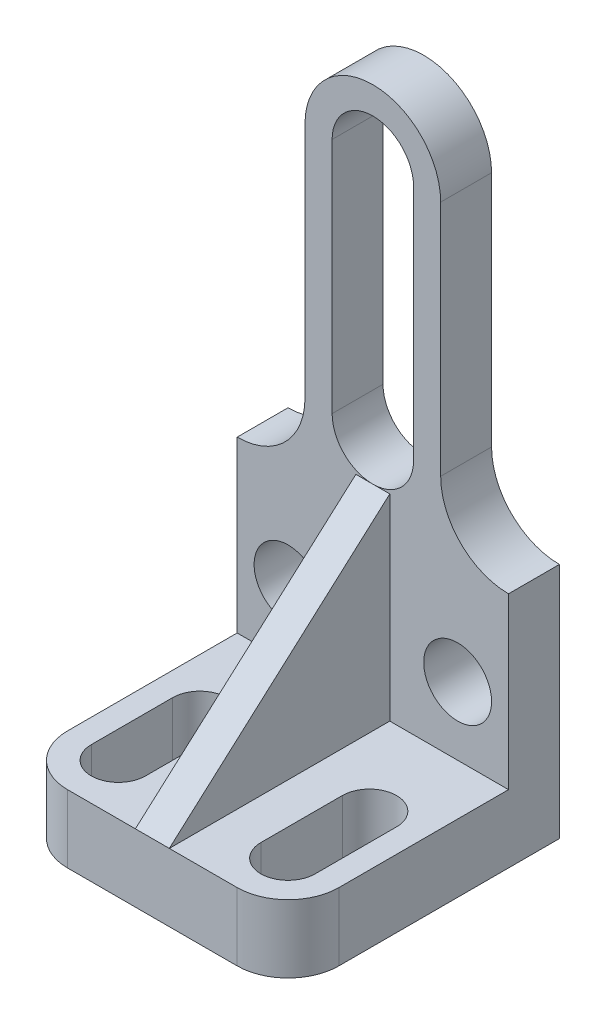
from build123d import *

# Parameters (mm, degrees)
BOSS_EXTRUDE1_DEPTH = 80
FILLET1_R           = 15
CUT_EXTRUDE1_DEPTH  = 196.959179423
SKETCH14_R          = 10
CUT_EXTRUDE2_DEPTH  = 208.424685127
CUT_EXTRUDE4_DEPTH  = 208.424685127
FILLET2_R           = 20
FILLET3_R           = 20
RIB7_REACH          = 202.998
SKETCH21_WALL_W     = 491.109891544
SKETCH21_WALL_H     = 10
CUT_EXTRUDE5_DEPTH  = 6


with BuildPart() as part:
    # Sketch1 → Boss-Extrude1 (new body)
    with BuildSketch(Plane(origin=(0, 0, 0), x_dir=(0, 0, -1), z_dir=(1, 0, 0))):
        Polygon((0, 0), (0, 180), (-15, 180), (-15, 20), (-80, 20), (-80, 0), align=None)
    extrude(amount=-BOSS_EXTRUDE1_DEPTH)

    # Fillet1
    fillet1_edges = [part.edges().sort_by_distance(p)[0] for p in [
        (-80, 10, 80),
        (0, 10, 80),
    ]]
    fillet(fillet1_edges, radius=FILLET1_R)

    # Sketch8 → Cut-Extrude1 (cut, through all)
    with BuildSketch(Plane(origin=(0, 20, 0), x_dir=(1, 0, 0), z_dir=(0, 1, 0))):
        with BuildLine():
            Line((-73, -65), (-73, -41))
            ThreePointArc((-73, -41), (-65, -33), (-57, -41))
            Line((-57, -41), (-57, -65))
            ThreePointArc((-57, -65), (-65, -73), (-73, -65))
        make_face()
        with BuildLine():
            Line((-23, -65), (-23, -41))
            ThreePointArc((-23, -41), (-15, -33), (-7, -41))
            Line((-7, -41), (-7, -65))
            ThreePointArc((-7, -65), (-15, -73), (-23, -65))
        make_face()
    extrude(amount=-CUT_EXTRUDE1_DEPTH, mode=Mode.SUBTRACT)

    # Sketch14 → Cut-Extrude2 (cut, through all)
    with BuildSketch(Plane.XY.offset(15)):
        with Locations((-65, 40)):
            Circle(SKETCH14_R)
        with Locations((-15, 40)):
            Circle(SKETCH14_R)
    extrude(amount=-CUT_EXTRUDE2_DEPTH, mode=Mode.SUBTRACT)

    # Sketch11 → Cut-Extrude4 (cut, through all)
    with BuildSketch(Plane.XY.offset(15)):
        with BuildLine():
            Line((-60, 70), (-60, 160))
            ThreePointArc((-60, 160), (-54.142135624, 174.142135624), (-40, 180))
            Line((-40, 180), (-80, 180))
            Line((-80, 180), (-80, 70))
            Line((-80, 70), (-60, 70))
        make_face()
        with BuildLine():
            Line((0, 180), (-40, 180))
            ThreePointArc((-40, 180), (-25.857864376, 174.142135624), (-20, 160))
            Line((-20, 160), (-20, 70))
            Line((-20, 70), (0, 70))
            Line((0, 70), (0, 180))
        make_face()
        with BuildLine():
            Line((-52, 160), (-52, 90))
            ThreePointArc((-52, 90), (-40, 78), (-28, 90))
            Line((-28, 90), (-28, 160))
            ThreePointArc((-28, 160), (-40, 172), (-52, 160))
        make_face()
    extrude(amount=-CUT_EXTRUDE4_DEPTH, mode=Mode.SUBTRACT)

    # Fillet2
    fillet2_edges = [part.edges().sort_by_distance(p)[0] for p in [
        (-20, 70, 7.5),
    ]]
    fillet(fillet2_edges, radius=FILLET2_R - 0.0001)  # a hair under: the kernel refuses the full size

    # Fillet3
    fillet3_edges = [part.edges().sort_by_distance(p)[0] for p in [
        (-60, 70, 7.5),
    ]]
    fillet(fillet3_edges, radius=FILLET3_R - 0.0001)  # a hair under: the kernel refuses the full size

    # Sketch21 wall → Rib7 (add, up to next)
    with BuildSketch(Plane(origin=(-40, 49, 47.5), x_dir=(0, -0.665787622684, 0.746141301284), z_dir=(0, -0.746141301284, -0.665787622684)), mode=Mode.PRIVATE) as rib7_sk1:
        Rectangle(SKETCH21_WALL_W, SKETCH21_WALL_H)
    rib7_tool1 = extrude(rib7_sk1.sketch, amount=RIB7_REACH, mode=Mode.PRIVATE) - part.part
    add(rib7_tool1.solids().sort_by_distance((-40, 49, 47.5))[0])

    # Sketch22 → Cut-Extrude5 (cut)
    # profile 1 of 7: a face of its own
    with BuildSketch(Plane.ZY.offset(80)):
        with BuildLine():
            Line((3.679487179, 2.857772436), (3.404647436, 2.647435897))
            add(Edge.make_bspline(
                [(3.404647436, 2.647435897), (3.385041548, 2.670801867), (3.346094101, 2.717218783), (3.283434898, 2.782398327), (3.218133255, 2.843463589), (3.150214134, 2.900705469), (3.078455015, 2.952122234), (3.004594216, 3.000393337), (2.927396171, 3.043661075), (2.820644436, 3.096124061), (2.680996588, 3.150870216), (2.505201749, 3.196773448), (2.32169065, 3.225994623), (2.196493051, 3.229159465), (2.1328125, 3.230769231)],
                knots=[0, 0, 0, 0, 0.757959112, 1.505699292, 2.245454638, 2.979532153, 3.711538275, 4.438200793, 5.171680507, 5.909471876, 7.393775596, 8.890124382, 10.418191784, 12, 12, 12, 12], degree=3))
            add(Edge.make_bspline(
                [(2.1328125, 3.230769231), (2.097729201, 3.230365268), (2.027888208, 3.229561092), (1.924239735, 3.218951967), (1.822526683, 3.204040757), (1.722815217, 3.181915434), (1.625232259, 3.153942815), (1.529139857, 3.120517401), (1.435929257, 3.079162561), (1.344311019, 3.033454301), (1.256531808, 2.981826856), (1.17347676, 2.925513504), (1.095448792, 2.865144408), (1.02238618, 2.800493302), (0.954214231, 2.731851341), (0.891426921, 2.658487), (0.83424151, 2.580634826), (0.781524485, 2.499321419), (0.734311752, 2.414783627), (0.694781873, 2.326708556), (0.65977675, 2.236604453), (0.632077508, 2.143453293), (0.610152991, 2.047910527), (0.595025328, 1.949719739), (0.584536856, 1.849086059), (0.58373668, 1.780876747), (0.583333333, 1.746494391)],
                knots=[0, 0, 0, 0, 1.054917814, 2.100044995, 3.131103042, 4.146048494, 5.169673617, 6.183595914, 7.203665975, 8.234915748, 9.262203917, 10.264457458, 11.251630812, 12.227803204, 13.197192746, 14.159520551, 15.12972552, 16.100847026, 17.073214652, 18.039054194, 19.002613845, 19.979014051, 20.95965708, 21.949030935, 22.966165397, 24, 24, 24, 24], degree=3))
            add(Edge.make_bspline(
                [(0.583333333, 1.746494391), (0.584595152, 1.694763071), (0.587072567, 1.593195486), (0.609120901, 1.444424876), (0.642625992, 1.301904202), (0.692841569, 1.16652436), (0.75476062, 1.036616002), (0.833001231, 0.914377148), (0.923617768, 0.797960584), (1.027892188, 0.690117636), (1.142298004, 0.591603911), (1.265045915, 0.504853329), (1.395830203, 0.432538447), (1.533206833, 0.3723625), (1.678232947, 0.326105772), (1.83064775, 0.293541649), (1.990119745, 0.272299468), (2.099089145, 0.27026578), (2.154547276, 0.269230769)],
                knots=[0, 0, 0, 0, 1.029171465, 2.020641659, 2.987623507, 3.938342917, 4.889210282, 5.84687017, 6.821220943, 7.821438502, 8.827599549, 9.822697543, 10.807740252, 11.797342354, 12.80366471, 13.83203677, 14.896651826, 16, 16, 16, 16], degree=3))
            add(Edge.make_bspline(
                [(2.154547276, 0.269230769), (2.215649965, 0.270919549), (2.335914674, 0.274243472), (2.5122827, 0.302402721), (2.681118466, 0.348060638), (2.842431052, 0.411958561), (2.995765698, 0.495023849), (3.141362359, 0.595721726), (3.279343929, 0.715010059), (3.362315211, 0.806093187), (3.404647436, 0.852564103)],
                knots=[0, 0, 0, 0, 1.028121516, 2.023589091, 2.998037872, 3.967518031, 4.937445131, 5.927275754, 6.942489185, 8, 8, 8, 8], degree=3))
            Line((3.404647436, 0.852564103), (3.679487179, 0.644330929))
            add(Edge.make_bspline(
                [(3.679487179, 0.644330929), (3.65736907, 0.615792478), (3.613238794, 0.558852271), (3.541780777, 0.478580562), (3.46650348, 0.403076526), (3.38684777, 0.332948905), (3.303729978, 0.266794439), (3.215657666, 0.206492608), (3.123788634, 0.151201724), (3.028434155, 0.100574799), (2.929695542, 0.055657552), (2.827691107, 0.017203784), (2.722860531, -0.015921105), (2.615199023, -0.043173042), (2.504483266, -0.064444126), (2.391112792, -0.078663801), (2.274842917, -0.088405715), (2.196401496, -0.089293631), (2.156650641, -0.08974359)],
                knots=[0, 0, 0, 0, 0.986787822, 1.968848986, 2.935600012, 3.899624008, 4.868462664, 5.837806735, 6.815139263, 7.798259679, 8.787526145, 9.778297419, 10.776456485, 11.791383307, 12.812564526, 13.85620153, 14.913611965, 16, 16, 16, 16], degree=3))
            add(Edge.make_bspline(
                [(2.156650641, -0.08974359), (2.119006974, -0.089481597), (2.044571284, -0.088963539), (1.934672532, -0.080571372), (1.827682951, -0.069121635), (1.723908326, -0.051881504), (1.622782351, -0.031537164), (1.525221766, -0.004265907), (1.430266556, 0.026283259), (1.338298215, 0.062188246), (1.249238515, 0.102704429), (1.163374704, 0.148495987), (1.080746271, 0.199177852), (1.000540851, 0.253632863), (0.923943267, 0.313610164), (0.850289742, 0.378276799), (0.779167265, 0.44741481), (0.73516458, 0.497269663), (0.713040865, 0.522335737)],
                knots=[0, 0, 0, 0, 1.114604814, 2.203992996, 3.262667896, 4.300477797, 5.318619304, 6.316056647, 7.298880507, 8.271930387, 9.238335007, 10.195173496, 11.151986948, 12.108099108, 13.064862484, 14.031167946, 15.010108607, 16, 16, 16, 16], degree=3))
            add(Edge.make_bspline(
                [(0.713040865, 0.522335737), (0.677605222, 0.565876926), (0.607161745, 0.652433637), (0.517036062, 0.792719618), (0.439888506, 0.939187827), (0.377512586, 1.092607755), (0.328749852, 1.252635143), (0.294968657, 1.419350657), (0.273017053, 1.592598599), (0.270506764, 1.710435388), (0.269230769, 1.770332532)],
                knots=[0, 0, 0, 0, 0.994628077, 1.977248131, 2.950237994, 3.925870899, 4.908910175, 5.911660606, 6.938484602, 8, 8, 8, 8], degree=3))
            add(Edge.make_bspline(
                [(0.269230769, 1.770332532), (0.270785963, 1.833287986), (0.273845709, 1.95714891), (0.299841504, 2.138922863), (0.341660301, 2.313074262), (0.401057189, 2.479278007), (0.476362541, 2.638408287), (0.569389154, 2.789249492), (0.679056297, 2.932766292), (0.804503864, 3.066781043), (0.9420712, 3.189320396), (1.089390014, 3.297126599), (1.24617196, 3.386844115), (1.410689812, 3.461840278), (1.584175494, 3.519484741), (1.766258863, 3.559837928), (1.956597778, 3.584955044), (2.086460203, 3.588130252), (2.15244391, 3.58974359)],
                knots=[0, 0, 0, 0, 1.032925535, 2.032216505, 3.007276963, 3.968222605, 4.92396291, 5.891752235, 6.871517503, 7.883894988, 8.900124299, 9.891468569, 10.874487609, 11.85992873, 12.854644235, 13.869047385, 14.917252991, 16, 16, 16, 16], degree=3))
            add(Edge.make_bspline(
                [(2.15244391, 3.58974359), (2.192658382, 3.589261452), (2.272258879, 3.588307108), (2.390011532, 3.579000965), (2.504653859, 3.563487359), (2.616264841, 3.542371289), (2.725387457, 3.516163968), (2.831187698, 3.48202367), (2.934286385, 3.442987138), (3.034033293, 3.398028672), (3.129949843, 3.347561931), (3.222006162, 3.292146307), (3.30947102, 3.231850502), (3.392959869, 3.167187326), (3.47107608, 3.096788767), (3.546037558, 3.022591171), (3.615298637, 2.942457347), (3.658051832, 2.886052413), (3.679487179, 2.857772436)],
                knots=[0, 0, 0, 0, 1.096760587, 2.17092713, 3.219439832, 4.250915756, 5.268269357, 6.278326846, 7.281116186, 8.274029601, 9.260640565, 10.235837813, 11.203064059, 12.156899882, 13.114053108, 14.069676657, 15.032185724, 16, 16, 16, 16], degree=3))
        make_face()
    # profile 2 of 7: a face of its own
    with BuildSketch(Plane.ZY.offset(80)):
        with BuildLine():
            Line((4.307692308, 3.58974359), (4.621794872, 3.58974359))
            Line((4.621794872, 3.58974359), (4.621794872, 2.074619391))
            add(Edge.make_bspline(
                [(4.621794872, 2.074619391), (4.655512173, 2.116763373), (4.721161487, 2.198819866), (4.831657604, 2.305881057), (4.945128476, 2.398679678), (5.065493286, 2.472550135), (5.190543806, 2.530906678), (5.320807451, 2.572294325), (5.456308422, 2.597745421), (5.548333572, 2.600943839), (5.594951923, 2.602564103)],
                knots=[0, 0, 0, 0, 1.125788106, 2.19196713, 3.20547328, 4.180437432, 5.132270164, 6.079753143, 7.027236121, 8, 8, 8, 8], degree=3))
            add(Edge.make_bspline(
                [(5.594951923, 2.602564103), (5.642282316, 2.600818672), (5.734919311, 2.597402444), (5.869800774, 2.570389063), (5.995761649, 2.524231625), (6.112427492, 2.4610646), (6.217252189, 2.382391773), (6.310101953, 2.29156025), (6.385942752, 2.186286332), (6.437541869, 2.089030078), (6.471115277, 2.002491324), (6.492367103, 1.928254812), (6.510386301, 1.845532899), (6.526086037, 1.754368166), (6.536549619, 1.654322995), (6.544954237, 1.545848741), (6.550930691, 1.428951622), (6.551162295, 1.348031373), (6.551282051, 1.306189904)],
                knots=[0, 0, 0, 0, 1.235656852, 2.418478516, 3.575258207, 4.727955599, 5.870717718, 6.98870536, 8.107142894, 9.245821548, 9.854588956, 10.528768408, 11.260415777, 12.065282286, 12.943670737, 13.886611085, 14.907229059, 16, 16, 16, 16], degree=3))
            Line((6.551282051, 1.306189904), (6.551282051, 0))
            Line((6.551282051, 0), (6.237179487, 0))
            Line((6.237179487, 0), (6.237179487, 1.203125))
            add(Edge.make_bspline(
                [(6.237179487, 1.203125), (6.236989184, 1.23794767), (6.236625166, 1.30455751), (6.235421822, 1.399923618), (6.232735607, 1.486419753), (6.228394781, 1.563768705), (6.223829473, 1.632078308), (6.217546156, 1.691249362), (6.210235922, 1.741363138), (6.203667141, 1.771527766), (6.200721154, 1.78505609)],
                knots=[0, 0, 0, 0, 1.430932559, 2.737130458, 3.918967929, 4.986496826, 5.920444988, 6.731744033, 7.431208747, 8, 8, 8, 8], degree=3))
            add(Edge.make_bspline(
                [(6.200721154, 1.78505609), (6.189296909, 1.824750353), (6.167333864, 1.901062344), (6.116285887, 2.004724754), (6.052526876, 2.093109495), (5.974679614, 2.165023783), (5.88412125, 2.221435322), (5.780261286, 2.260503105), (5.664077218, 2.284750827), (5.582225746, 2.28719013), (5.539563301, 2.288461538)],
                knots=[0, 0, 0, 0, 1.090059168, 2.095632401, 3.037101401, 3.955032261, 4.878929692, 5.839099886, 6.873700383, 8, 8, 8, 8], degree=3))
            add(Edge.make_bspline(
                [(5.539563301, 2.288461538), (5.514295528, 2.287985712), (5.464291258, 2.287044064), (5.390142592, 2.277590166), (5.318213529, 2.262141447), (5.247811351, 2.241236908), (5.180428153, 2.212791372), (5.114099828, 2.179861183), (5.050705619, 2.139552928), (4.989119802, 2.09432716), (4.931802269, 2.0442574), (4.878475153, 1.991410445), (4.830936813, 1.935135481), (4.787868222, 1.876335365), (4.750689937, 1.814203572), (4.718236854, 1.749339253), (4.690701158, 1.681657108), (4.677018466, 1.634682046), (4.670172276, 1.611177885)],
                knots=[0, 0, 0, 0, 1.024319606, 2.027102035, 3.025350316, 4.005802111, 5.00026367, 5.987881639, 7.005602596, 8.042517216, 9.083927026, 10.089214625, 11.084353441, 12.06828073, 13.041928858, 14.016821737, 15.00770877, 16, 16, 16, 16], degree=3))
            add(Edge.make_bspline(
                [(4.670172276, 1.611177885), (4.666232848, 1.594156934), (4.657648352, 1.557066187), (4.648333518, 1.495891863), (4.639995722, 1.424805491), (4.632947172, 1.34391489), (4.628624086, 1.252923648), (4.623965845, 1.152452689), (4.622231831, 1.041872668), (4.621944878, 0.964977161), (4.621794872, 0.924779647)],
                knots=[0, 0, 0, 0, 0.607992626, 1.324890765, 2.152360218, 3.099583803, 4.150613268, 5.323148443, 6.60066238, 8, 8, 8, 8], degree=3))
            Line((4.621794872, 0.924779647), (4.621794872, 0))
            Line((4.621794872, 0), (4.307692308, 0))
            Line((4.307692308, 0), (4.307692308, 3.58974359))
        make_face()
    # profile 3 of 7: a face of its own
    with BuildSketch(Plane.ZY.offset(80)):
        with BuildLine():
            Line((9.871794872, 2.557692308), (9.871794872, 0))
            Line((9.871794872, 0), (9.557692308, 0))
            Line((9.557692308, 0), (9.557692308, 0.442407853))
            add(Edge.make_bspline(
                [(9.557692308, 0.442407853), (9.522273517, 0.402368259), (9.453153302, 0.324230488), (9.337712184, 0.222148315), (9.215344006, 0.137769993), (9.086642685, 0.069620078), (8.951724441, 0.018428021), (8.810888354, -0.017958138), (8.664076973, -0.041351973), (8.563824619, -0.043687995), (8.513020833, -0.044871795)],
                knots=[0, 0, 0, 0, 1.074387032, 2.096679803, 3.090159297, 4.057316773, 5.018401886, 5.985159533, 6.978961417, 8, 8, 8, 8], degree=3))
            add(Edge.make_bspline(
                [(8.513020833, -0.044871795), (8.46785288, -0.043645423), (8.378779675, -0.041226962), (8.247750597, -0.022464659), (8.121658348, 0.007665963), (8.000383775, 0.049566853), (7.88471163, 0.105147674), (7.773651533, 0.171688922), (7.667778841, 0.250929752), (7.568707302, 0.341517781), (7.477475302, 0.439912768), (7.397414029, 0.544858315), (7.330660949, 0.655900619), (7.274840869, 0.771633773), (7.231844524, 0.892948692), (7.20187089, 1.01942586), (7.183130443, 1.150915734), (7.180712983, 1.240455257), (7.179487179, 1.285857372)],
                knots=[0, 0, 0, 0, 1.033919861, 2.038935746, 3.024066025, 3.998881131, 4.97069526, 5.957263378, 6.95902576, 7.993208707, 9.027059324, 10.027763471, 11.009749337, 11.988697705, 12.965288445, 13.950418724, 14.960734635, 16, 16, 16, 16], degree=3))
            add(Edge.make_bspline(
                [(7.179487179, 1.285857372), (7.180740151, 1.330321075), (7.183217208, 1.418223419), (7.201670428, 1.547502117), (7.232701436, 1.672020377), (7.276249284, 1.791377321), (7.332091239, 1.905717371), (7.400019326, 2.015121396), (7.480038451, 2.119890793), (7.572290858, 2.21756202), (7.672225628, 2.307782634), (7.779134359, 2.38619168), (7.89035764, 2.453908529), (8.00762065, 2.507562005), (8.129187755, 2.550971109), (8.256141201, 2.581004078), (8.38795278, 2.598701399), (8.477443272, 2.601264163), (8.522836538, 2.602564103)],
                knots=[0, 0, 0, 0, 1.020392517, 2.01726096, 2.990465484, 3.961182959, 4.928053699, 5.906110375, 6.912531644, 7.948652711, 8.985773172, 9.998621852, 10.987621588, 11.969261332, 12.953316658, 13.946091881, 14.958173133, 16, 16, 16, 16], degree=3))
            add(Edge.make_bspline(
                [(8.522836538, 2.602564103), (8.575036398, 2.601126351), (8.677397858, 2.598306988), (8.827125867, 2.574844261), (8.968770345, 2.535205794), (9.103424697, 2.481288296), (9.230605383, 2.409639567), (9.349108367, 2.319259606), (9.46017385, 2.210718419), (9.524554142, 2.127347974), (9.557692308, 2.084435096)],
                knots=[0, 0, 0, 0, 1.038897134, 2.037228247, 3.008116434, 3.962042015, 4.918381754, 5.904844433, 6.921570401, 8, 8, 8, 8], degree=3))
            Line((9.557692308, 2.084435096), (9.557692308, 2.557692308))
            Line((9.557692308, 2.557692308), (9.871794872, 2.557692308))
        make_face()
        with BuildLine():
            add(Edge.make_bspline(
                [(8.527043269, 2.288461538), (8.481128931, 2.286827901), (8.390501331, 2.28360336), (8.257457329, 2.258429865), (8.130143915, 2.21654527), (8.009197841, 2.159263369), (7.896529624, 2.087234632), (7.795835954, 2.000113249), (7.706293252, 1.900276235), (7.630984988, 1.788174125), (7.569594491, 1.667996033), (7.526427459, 1.542371595), (7.497958212, 1.413566618), (7.495049691, 1.326203932), (7.493589744, 1.282351763)],
                knots=[0, 0, 0, 0, 1.031046209, 2.035121221, 3.029706178, 4.034933723, 5.034054252, 6.02443088, 7.017295772, 8.038157696, 9.050218397, 10.03989886, 11.016116709, 12, 12, 12, 12], degree=3))
            add(Edge.make_bspline(
                [(7.493589744, 1.282351763), (7.495454637, 1.238761656), (7.499177114, 1.1517523), (7.525927808, 1.022771723), (7.570807682, 0.897117681), (7.632049744, 0.775856687), (7.708736369, 0.663272587), (7.797625022, 0.561532464), (7.899575303, 0.474042876), (8.01250281, 0.400805303), (8.13311078, 0.341642782), (8.259944712, 0.300477142), (8.39062035, 0.273899362), (8.479472684, 0.270794885), (8.524238782, 0.269230769)],
                knots=[0, 0, 0, 0, 0.979072187, 1.954306742, 2.945804271, 3.96968567, 4.997920485, 5.998718438, 6.996577872, 8.005894225, 9.015743152, 10.005417472, 10.995077863, 12, 12, 12, 12], degree=3))
            add(Edge.make_bspline(
                [(8.524238782, 0.269230769), (8.569685285, 0.270890733), (8.660073871, 0.274192237), (8.793512579, 0.299473502), (8.923007542, 0.3412423), (9.04679477, 0.399141427), (9.162110902, 0.470898783), (9.265608779, 0.554905874), (9.353124748, 0.652609058), (9.427317357, 0.759985511), (9.485492774, 0.877697508), (9.527868833, 1.003031698), (9.552922739, 1.135992447), (9.556080468, 1.226856374), (9.557692308, 1.273237179)],
                knots=[0, 0, 0, 0, 1.01762866, 2.023962475, 3.030623092, 4.058876274, 5.077231937, 6.066672613, 7.034107872, 8.005628644, 8.981990164, 9.965428785, 10.961468474, 12, 12, 12, 12], degree=3))
            add(Edge.make_bspline(
                [(9.557692308, 1.273237179), (9.556732651, 1.30857501), (9.554843744, 1.378131043), (9.540413174, 1.480258561), (9.517458248, 1.577992287), (9.485112078, 1.671434976), (9.442620794, 1.760069991), (9.391373028, 1.844533752), (9.330467578, 1.924386963), (9.260884882, 1.998530034), (9.184719679, 2.066156496), (9.104125139, 2.126520737), (9.018146392, 2.17610951), (8.928229355, 2.217150781), (8.83421802, 2.249809931), (8.7353474, 2.271597625), (8.632668414, 2.286557946), (8.562622358, 2.287820327), (8.527043269, 2.288461538)],
                knots=[0, 0, 0, 0, 1.050140795, 2.067009409, 3.05949893, 4.030605086, 5.00011959, 5.97591094, 6.962425594, 7.979863591, 8.993523472, 9.986985069, 10.967611495, 11.937549037, 12.921786183, 13.919465291, 14.943216303, 16, 16, 16, 16], degree=3))
        make_face(mode=Mode.SUBTRACT)
    # profile 4 of 7: a face of its own
    with BuildSketch(Plane.ZY.offset(80)):
        with BuildLine():
            Line((10.58974359, 2.557692308), (10.903846154, 2.557692308))
            Line((10.903846154, 2.557692308), (10.903846154, 2.096354167))
            add(Edge.make_bspline(
                [(10.903846154, 2.096354167), (10.937383789, 2.13819689), (11.00246474, 2.219394153), (11.110849073, 2.326114728), (11.225392974, 2.414059953), (11.345394977, 2.484163747), (11.471017987, 2.537010373), (11.601496257, 2.575176304), (11.737610963, 2.598061132), (11.8301754, 2.601051363), (11.877003205, 2.602564103)],
                knots=[0, 0, 0, 0, 1.12780773, 2.188550248, 3.19190651, 4.159438251, 5.104880172, 6.052711206, 7.014878035, 8, 8, 8, 8], degree=3))
            add(Edge.make_bspline(
                [(11.877003205, 2.602564103), (11.924333839, 2.600818907), (12.016971307, 2.597403139), (12.151849368, 2.570386448), (12.277822762, 2.524241192), (12.394442318, 2.461029122), (12.499569531, 2.382422649), (12.591894383, 2.290844867), (12.66825763, 2.185508784), (12.719454993, 2.087785627), (12.753180641, 2.001096833), (12.774412978, 1.926850083), (12.79244396, 1.844131932), (12.808075708, 1.753192343), (12.81865282, 1.653394153), (12.826995111, 1.545146461), (12.832973805, 1.42848433), (12.833211012, 1.347797703), (12.833333333, 1.306189904)],
                knots=[0, 0, 0, 0, 1.235846778, 2.418850247, 3.575807741, 4.728682307, 5.871620074, 6.994088408, 8.11269785, 9.256955736, 9.865816715, 10.540099792, 11.271859618, 12.076849838, 12.949306005, 13.892391288, 14.913166135, 16, 16, 16, 16], degree=3))
            Line((12.833333333, 1.306189904), (12.833333333, 0))
            Line((12.833333333, 0), (12.519230769, 0))
            Line((12.519230769, 0), (12.519230769, 1.203125))
            add(Edge.make_bspline(
                [(12.519230769, 1.203125), (12.519037561, 1.237947445), (12.518667987, 1.304556856), (12.51750234, 1.399925879), (12.514692534, 1.486412457), (12.510744221, 1.563809825), (12.50496519, 1.632043661), (12.498942559, 1.691252938), (12.491577582, 1.74136248), (12.485014669, 1.771527563), (12.482071314, 1.78505609)],
                knots=[0, 0, 0, 0, 1.430800155, 2.736877192, 3.918605307, 4.986035426, 5.920637409, 6.731861385, 7.431261377, 8, 8, 8, 8], degree=3))
            add(Edge.make_bspline(
                [(12.482071314, 1.78505609), (12.471445783, 1.824767275), (12.450994922, 1.901199019), (12.400460939, 2.004873372), (12.336646758, 2.09307156), (12.258748909, 2.165248281), (12.167519833, 2.221419118), (12.06321269, 2.260393073), (11.94683405, 2.284769342), (11.864979667, 2.287196474), (11.822315705, 2.288461538)],
                knots=[0, 0, 0, 0, 1.084156227, 2.086665306, 3.027808233, 3.945421172, 4.874247719, 5.839848303, 6.874090471, 8, 8, 8, 8], degree=3))
            add(Edge.make_bspline(
                [(11.822315705, 2.288461538), (11.797048022, 2.287985534), (11.747043929, 2.287043533), (11.672893957, 2.277592235), (11.600969783, 2.262133779), (11.530549574, 2.241265142), (11.463041781, 2.212602873), (11.39627749, 2.180073502), (11.332770725, 2.13952529), (11.271167328, 2.094334669), (11.213854521, 2.044255462), (11.160526182, 1.991410952), (11.112988162, 1.935135348), (11.069919487, 1.8763354), (11.032741223, 1.814203562), (11.000288135, 1.749339256), (10.97275244, 1.681657107), (10.959069748, 1.634682046), (10.952223558, 1.611177885)],
                knots=[0, 0, 0, 0, 1.023777757, 2.026029729, 3.023749952, 4.003683103, 4.997618607, 5.993177895, 7.010360494, 8.046726602, 9.087585522, 10.09234134, 11.086953743, 12.070360549, 13.043493632, 14.017870808, 15.008233677, 16, 16, 16, 16], degree=3))
            add(Edge.make_bspline(
                [(10.952223558, 1.611177885), (10.948283909, 1.593922682), (10.9397075, 1.556359007), (10.93044432, 1.494714588), (10.922036745, 1.423404613), (10.914999786, 1.342512296), (10.91069437, 1.251754421), (10.905999973, 1.151518583), (10.904290912, 1.041405094), (10.903998558, 0.964743402), (10.903846154, 0.924779647)],
                knots=[0, 0, 0, 0, 0.615963638, 1.340920617, 2.168419149, 3.115676021, 4.16674242, 5.331190069, 6.6087489, 8, 8, 8, 8], degree=3))
            Line((10.903846154, 0.924779647), (10.903846154, 0))
            Line((10.903846154, 0), (10.58974359, 0))
            Line((10.58974359, 0), (10.58974359, 2.557692308))
        make_face()
    # profile 5 of 7: a face of its own
    with BuildSketch(Plane.ZY.offset(80)):
        with BuildLine():
            Line((13.506410256, 2.557692308), (13.820512821, 2.557692308))
            Line((13.820512821, 2.557692308), (13.820512821, 1.371394231))
            add(Edge.make_bspline(
                [(13.820512821, 1.371394231), (13.820654725, 1.336571482), (13.820926183, 1.269957194), (13.822767124, 1.174102007), (13.827097217, 1.086685294), (13.832511042, 1.007656557), (13.839473178, 0.937029166), (13.847756539, 0.875049809), (13.85701496, 0.821015625), (13.866077674, 0.788472269), (13.870292468, 0.77333734)],
                knots=[0, 0, 0, 0, 1.388932606, 2.656963016, 3.823490214, 4.879454478, 5.816252168, 6.653371382, 7.373723809, 8, 8, 8, 8], degree=3))
            add(Edge.make_bspline(
                [(13.870292468, 0.77333734), (13.877053923, 0.754314469), (13.890436264, 0.716664208), (13.914709748, 0.662275202), (13.944738084, 0.61189992), (13.977597912, 0.563595847), (14.01549732, 0.51879386), (14.057956791, 0.477569617), (14.103555028, 0.438365526), (14.171310051, 0.391980734), (14.263969317, 0.342265403), (14.385622073, 0.299369585), (14.517526299, 0.273733765), (14.608691018, 0.27075951), (14.655548878, 0.269230769)],
                knots=[0, 0, 0, 0, 0.725840625, 1.436591201, 2.137033971, 2.831655856, 3.53531722, 4.242432219, 4.957935707, 5.694543706, 7.190802206, 8.724350549, 10.316345118, 12, 12, 12, 12], degree=3))
            add(Edge.make_bspline(
                [(14.655548878, 0.269230769), (14.702402386, 0.270792018), (14.793055254, 0.273812745), (14.923510224, 0.298596284), (15.042761638, 0.340001973), (15.149612589, 0.397809384), (15.243578429, 0.468551447), (15.321882848, 0.551560256), (15.386490103, 0.644209643), (15.414699523, 0.713333922), (15.428886218, 0.748096955)],
                knots=[0, 0, 0, 0, 1.157059328, 2.238695713, 3.266970494, 4.264342957, 5.228770407, 6.160125903, 7.074715775, 8, 8, 8, 8], degree=3))
            add(Edge.make_bspline(
                [(15.428886218, 0.748096955), (15.433080448, 0.762063254), (15.442352866, 0.792939329), (15.452315218, 0.845319078), (15.461289679, 0.907783682), (15.468952856, 0.980741891), (15.474418018, 1.064003043), (15.477364045, 1.157541119), (15.48069232, 1.26106248), (15.480742836, 1.333530239), (15.480769231, 1.371394231)],
                knots=[0, 0, 0, 0, 0.557542046, 1.232589297, 2.036731608, 2.971723315, 4.038036528, 5.22795436, 6.551621927, 8, 8, 8, 8], degree=3))
            Line((15.480769231, 1.371394231), (15.480769231, 2.557692308))
            Line((15.480769231, 2.557692308), (15.794871795, 2.557692308))
            Line((15.794871795, 2.557692308), (15.794871795, 1.3125))
            add(Edge.make_bspline(
                [(15.794871795, 1.3125), (15.7944301, 1.270192829), (15.793573152, 1.188111129), (15.788065808, 1.068827017), (15.778616196, 0.957664772), (15.764273511, 0.854565552), (15.747407836, 0.759608071), (15.725651563, 0.672670625), (15.699673325, 0.594021071), (15.67036781, 0.522279294), (15.635745943, 0.4572324), (15.598918922, 0.395496583), (15.55639415, 0.338603648), (15.511623916, 0.283721511), (15.46182226, 0.233579983), (15.407922401, 0.187028507), (15.350682981, 0.143355476), (15.288833783, 0.104264196), (15.223277721, 0.069047551), (15.153933864, 0.037831473), (15.079952865, 0.013128896), (15.002289228, -0.00818177), (14.920562449, -0.024896239), (14.834851316, -0.036682806), (14.7451847, -0.043908137), (14.68407524, -0.044545182), (14.652744391, -0.044871795)],
                knots=[0, 0, 0, 0, 1.493040784, 2.896703357, 4.213163133, 5.428574705, 6.569057535, 7.615249723, 8.588095153, 9.490268104, 10.346124644, 11.18633936, 12.024365274, 12.850166724, 13.684164916, 14.514361689, 15.362232829, 16.222528818, 17.093394965, 17.986930858, 18.902426812, 19.842810585, 20.827885679, 21.843828298, 22.894529745, 24, 24, 24, 24], degree=3))
            add(Edge.make_bspline(
                [(14.652744391, -0.044871795), (14.621647877, -0.044532088), (14.560540332, -0.043864532), (14.470869088, -0.036722724), (14.384920481, -0.024914553), (14.303000083, -0.008059336), (14.225025685, 0.012979734), (14.150681446, 0.03798327), (14.080837883, 0.069063751), (14.014655879, 0.104041309), (13.95265349, 0.143606584), (13.894544912, 0.186974624), (13.84040806, 0.234080687), (13.790230992, 0.284728044), (13.744718015, 0.33954498), (13.703301973, 0.398090541), (13.665345268, 0.459784629), (13.630992478, 0.525847792), (13.601480722, 0.598419802), (13.575425477, 0.678716899), (13.554114838, 0.767619415), (13.53677237, 0.865051344), (13.522820929, 0.970546385), (13.513134787, 1.084714801), (13.507718956, 1.207278493), (13.506855895, 1.291928383), (13.506410256, 1.335637019)],
                knots=[0, 0, 0, 0, 1.083640291, 2.129454052, 3.13281866, 4.105697902, 5.042300162, 5.946461698, 6.836384745, 7.703652036, 8.553297018, 9.397182691, 10.228592656, 11.052265423, 11.879314572, 12.708807002, 13.549817954, 14.402308542, 15.300838682, 16.27712199, 17.341985831, 18.484375296, 19.725102775, 21.0496083, 22.476576903, 24, 24, 24, 24], degree=3))
            Line((13.506410256, 1.335637019), (13.506410256, 2.557692308))
        make_face()
    # profile 6 of 7: a face of its own
    with BuildSketch(Plane.ZY.offset(80)):
        with BuildLine():
            Line((16.512820513, 2.557692308), (16.826923077, 2.557692308))
            Line((16.826923077, 2.557692308), (16.826923077, 2.084435096))
            add(Edge.make_bspline(
                [(16.826923077, 2.084435096), (16.860280561, 2.12737283), (16.925104156, 2.210813723), (17.036829061, 2.318803851), (17.154755869, 2.409879155), (17.281919282, 2.481261688), (17.416342972, 2.5350825), (17.557475289, 2.57486195), (17.706514054, 2.598303424), (17.808410507, 2.601125086), (17.860376603, 2.602564103)],
                knots=[0, 0, 0, 0, 1.0828784, 2.104357462, 3.088488658, 4.04616522, 5.001424249, 5.969181776, 6.964304535, 8, 8, 8, 8], degree=3))
            add(Edge.make_bspline(
                [(17.860376603, 2.602564103), (17.905768206, 2.601250924), (17.995487094, 2.598655357), (18.127550323, 2.581082302), (18.254725707, 2.55096461), (18.37629376, 2.507563694), (18.493556826, 2.453908224), (18.604778926, 2.386191189), (18.711692481, 2.307784998), (18.81160867, 2.217552847), (18.903930038, 2.119924581), (18.983776219, 2.014902277), (19.052648123, 1.90593969), (19.10831842, 1.791347598), (19.151926767, 1.672028368), (19.182941445, 1.547499927), (19.201399088, 1.418223987), (19.20387554, 1.330321266), (19.205128205, 1.285857372)],
                knots=[0, 0, 0, 0, 1.041296284, 2.058176809, 3.050446431, 4.034000596, 5.01514041, 6.003636468, 7.015969324, 8.052561599, 9.08815499, 10.094063707, 11.074456064, 12.040834395, 13.011057502, 13.983766392, 14.980127149, 16, 16, 16, 16], degree=3))
            add(Edge.make_bspline(
                [(19.205128205, 1.285857372), (19.20390272, 1.240455063), (19.201485885, 1.150915159), (19.182740879, 1.019428062), (19.152784005, 0.892940688), (19.109725822, 0.771663424), (19.054084334, 0.655679773), (18.986379773, 0.545073377), (18.906493306, 0.439879674), (18.815192178, 0.341526774), (18.716139242, 0.250927461), (18.610261753, 0.171689391), (18.499202827, 0.105148016), (18.38353066, 0.049565056), (18.262255022, 0.007672872), (18.135941744, -0.022544929), (18.004659598, -0.041179424), (17.915358446, -0.043631567), (17.870192308, -0.044871795)],
                knots=[0, 0, 0, 0, 1.038740735, 2.04854663, 3.033179607, 4.009277356, 4.987731542, 5.972001279, 6.972200261, 8.005528982, 9.039189865, 10.040446548, 11.026516639, 11.997840187, 12.972163198, 13.956796175, 14.96660207, 16, 16, 16, 16], degree=3))
            add(Edge.make_bspline(
                [(17.870192308, -0.044871795), (17.819364736, -0.043576987), (17.71896538, -0.041019362), (17.572167709, -0.015099952), (17.430890857, 0.023636983), (17.296700033, 0.080335977), (17.16853222, 0.152591493), (17.047112414, 0.240701699), (16.931795661, 0.344482324), (16.862386904, 0.42321414), (16.826923077, 0.463441506)],
                knots=[0, 0, 0, 0, 1.014726462, 2.004382257, 2.969841629, 3.936926163, 4.907207904, 5.903978561, 6.929055279, 8, 8, 8, 8], degree=3))
            Line((16.826923077, 0.463441506), (16.826923077, -0.942307692))
            Line((16.826923077, -0.942307692), (16.512820513, -0.942307692))
            Line((16.512820513, -0.942307692), (16.512820513, 2.557692308))
        make_face()
        with BuildLine():
            add(Edge.make_bspline(
                [(17.857572115, 2.288461538), (17.821992553, 2.28782128), (17.751945565, 2.286560777), (17.649273346, 2.271586828), (17.550377918, 2.249849087), (17.456255967, 2.216937187), (17.366005351, 2.176538373), (17.280321186, 2.126056362), (17.199263618, 2.066404356), (17.123036588, 1.998725013), (17.054173294, 1.924150324), (16.993210366, 1.844562515), (16.942003061, 1.760062376), (16.899501041, 1.671437013), (16.867157758, 1.577991728), (16.844202039, 1.480258715), (16.829771686, 1.378131003), (16.827882748, 1.308574996), (16.826923077, 1.273237179)],
                knots=[0, 0, 0, 0, 1.05670511, 2.080379991, 3.077984906, 4.06214886, 5.038337365, 6.01289324, 7.01187578, 8.025460281, 9.038092164, 10.024533457, 11.000252242, 11.969694649, 12.940728589, 13.933144304, 14.949937299, 16, 16, 16, 16], degree=3))
            add(Edge.make_bspline(
                [(16.826923077, 1.273237179), (16.828513933, 1.226849067), (16.831630555, 1.135970826), (16.856967923, 1.003186704), (16.898203187, 0.877535048), (16.956731901, 0.760074011), (17.030679475, 0.652091176), (17.119777631, 0.55540057), (17.223220182, 0.470609979), (17.339287374, 0.399188725), (17.463709505, 0.341200659), (17.593495417, 0.299686448), (17.726860298, 0.27411422), (17.817028617, 0.270867401), (17.862479968, 0.269230769)],
                knots=[0, 0, 0, 0, 1.03728447, 2.032128127, 3.01272805, 3.987917167, 4.958271349, 5.931593992, 6.91984656, 7.941419022, 8.973179163, 9.983609215, 10.983593296, 12, 12, 12, 12], degree=3))
            add(Edge.make_bspline(
                [(17.862479968, 0.269230769), (17.907015736, 0.270787146), (17.995411229, 0.273876274), (18.12556935, 0.300614462), (18.252059989, 0.341459487), (18.372240161, 0.401019043), (18.485063649, 0.474009101), (18.586945203, 0.561569134), (18.675952116, 0.663059077), (18.751816471, 0.77606758), (18.812947956, 0.897242964), (18.858878196, 1.022624353), (18.88538677, 1.151769776), (18.889143558, 1.238767489), (18.891025641, 1.282351763)],
                knots=[0, 0, 0, 0, 1.00104056, 1.986885549, 2.97790532, 3.984399681, 4.995088187, 5.994304198, 6.996462723, 8.023150851, 9.048424203, 10.043036403, 11.019596776, 12, 12, 12, 12], degree=3))
            add(Edge.make_bspline(
                [(18.891025641, 1.282351763), (18.889570907, 1.326206752), (18.886672773, 1.413575056), (18.858125736, 1.542337959), (18.815225758, 1.668225935), (18.752666706, 1.787746484), (18.678465437, 1.900520567), (18.58871844, 2.000074446), (18.488102243, 2.087245119), (18.375413079, 2.159260529), (18.254472654, 2.216546024), (18.127157738, 2.258429663), (17.994114135, 2.283603412), (17.903486481, 2.286827918), (17.857572115, 2.288461538)],
                knots=[0, 0, 0, 0, 0.983928682, 1.960191568, 2.949917689, 3.96440592, 4.982380491, 5.975291189, 6.965713506, 7.964880129, 8.970154049, 9.96478489, 10.968906225, 12, 12, 12, 12], degree=3))
        make_face(mode=Mode.SUBTRACT)
    # profile 7 of 7: a face of its own
    with BuildSketch(Plane.ZY.offset(80)):
        with BuildLine():
            Line((22.435897436, 2.557692308), (22.435897436, 0))
            Line((22.435897436, 0), (22.121794872, 0))
            Line((22.121794872, 0), (22.121794872, 0.442407853))
            add(Edge.make_bspline(
                [(22.121794872, 0.442407853), (22.086376081, 0.402368259), (22.017255866, 0.324230488), (21.901814748, 0.222148315), (21.77944657, 0.137769993), (21.650745249, 0.069620078), (21.515827006, 0.018428021), (21.374990918, -0.017958138), (21.228179537, -0.041351973), (21.127927183, -0.043687995), (21.077123397, -0.044871795)],
                knots=[0, 0, 0, 0, 1.074387032, 2.096679803, 3.090159297, 4.057316773, 5.018401886, 5.985159533, 6.978961417, 8, 8, 8, 8], degree=3))
            add(Edge.make_bspline(
                [(21.077123397, -0.044871795), (21.031955444, -0.043645423), (20.942882239, -0.041226962), (20.811853162, -0.022464659), (20.685760912, 0.007665963), (20.564486339, 0.049566853), (20.448814194, 0.105147674), (20.337754097, 0.171688922), (20.231881405, 0.250929752), (20.132809866, 0.341517781), (20.041577866, 0.439912768), (19.961516593, 0.544858315), (19.894763514, 0.655900619), (19.838943433, 0.771633773), (19.795947088, 0.892948692), (19.765973454, 1.01942586), (19.747233007, 1.150915734), (19.744815547, 1.240455257), (19.743589744, 1.285857372)],
                knots=[0, 0, 0, 0, 1.033919861, 2.038935746, 3.024066025, 3.998881131, 4.97069526, 5.957263378, 6.95902576, 7.993208707, 9.027059324, 10.027763471, 11.009749337, 11.988697705, 12.965288445, 13.950418724, 14.960734635, 16, 16, 16, 16], degree=3))
            add(Edge.make_bspline(
                [(19.743589744, 1.285857372), (19.744842715, 1.330321075), (19.747319772, 1.418223419), (19.765772992, 1.547502117), (19.796804, 1.672020377), (19.840351848, 1.791377321), (19.896193803, 1.905717371), (19.96412189, 2.015121396), (20.044141015, 2.119890793), (20.136393422, 2.21756202), (20.236328192, 2.307782634), (20.343236923, 2.38619168), (20.454460204, 2.453908529), (20.571723215, 2.507562005), (20.693290319, 2.550971109), (20.820243765, 2.581004078), (20.952055344, 2.598701399), (21.041545836, 2.601264163), (21.086939103, 2.602564103)],
                knots=[0, 0, 0, 0, 1.020392517, 2.01726096, 2.990465484, 3.961182959, 4.928053699, 5.906110375, 6.912531644, 7.948652711, 8.985773172, 9.998621852, 10.987621588, 11.969261332, 12.953316658, 13.946091881, 14.958173133, 16, 16, 16, 16], degree=3))
            add(Edge.make_bspline(
                [(21.086939103, 2.602564103), (21.139138962, 2.601126351), (21.241500422, 2.598306988), (21.391228431, 2.574844261), (21.532872909, 2.535205794), (21.667527261, 2.481288296), (21.794707947, 2.409639567), (21.913210931, 2.319259606), (22.024276415, 2.210718419), (22.088656706, 2.127347974), (22.121794872, 2.084435096)],
                knots=[0, 0, 0, 0, 1.038897134, 2.037228247, 3.008116434, 3.962042015, 4.918381754, 5.904844433, 6.921570401, 8, 8, 8, 8], degree=3))
            Line((22.121794872, 2.084435096), (22.121794872, 2.557692308))
            Line((22.121794872, 2.557692308), (22.435897436, 2.557692308))
        make_face()
        with BuildLine():
            add(Edge.make_bspline(
                [(21.091145833, 2.288461538), (21.045231495, 2.286827901), (20.954603895, 2.28360336), (20.821559893, 2.258429865), (20.694246479, 2.21654527), (20.573300405, 2.159263369), (20.460632188, 2.087234632), (20.359938518, 2.000113249), (20.270395816, 1.900276235), (20.195087552, 1.788174125), (20.133697055, 1.667996033), (20.090530023, 1.542371595), (20.062060776, 1.413566618), (20.059152255, 1.326203932), (20.057692308, 1.282351763)],
                knots=[0, 0, 0, 0, 1.031046209, 2.035121221, 3.029706178, 4.034933723, 5.034054252, 6.02443088, 7.017295772, 8.038157696, 9.050218397, 10.03989886, 11.016116709, 12, 12, 12, 12], degree=3))
            add(Edge.make_bspline(
                [(20.057692308, 1.282351763), (20.059557201, 1.238761656), (20.063279678, 1.1517523), (20.090030372, 1.022771723), (20.134910246, 0.897117681), (20.196152308, 0.775856687), (20.272838933, 0.663272587), (20.361727586, 0.561532464), (20.463677867, 0.474042876), (20.576605374, 0.400805303), (20.697213344, 0.341642782), (20.824047276, 0.300477142), (20.954722914, 0.273899362), (21.043575248, 0.270794885), (21.088341346, 0.269230769)],
                knots=[0, 0, 0, 0, 0.979072187, 1.954306742, 2.945804271, 3.96968567, 4.997920485, 5.998718438, 6.996577872, 8.005894225, 9.015743152, 10.005417472, 10.995077863, 12, 12, 12, 12], degree=3))
            add(Edge.make_bspline(
                [(21.088341346, 0.269230769), (21.133787849, 0.270890733), (21.224176435, 0.274192237), (21.357615143, 0.299473502), (21.487110106, 0.3412423), (21.610897334, 0.399141427), (21.726213466, 0.470898783), (21.829711343, 0.554905874), (21.917227312, 0.652609058), (21.991419921, 0.759985511), (22.049595338, 0.877697508), (22.091971397, 1.003031698), (22.117025303, 1.135992447), (22.120183033, 1.226856374), (22.121794872, 1.273237179)],
                knots=[0, 0, 0, 0, 1.01762866, 2.023962475, 3.030623092, 4.058876274, 5.077231937, 6.066672613, 7.034107872, 8.005628644, 8.981990164, 9.965428785, 10.961468474, 12, 12, 12, 12], degree=3))
            add(Edge.make_bspline(
                [(22.121794872, 1.273237179), (22.120835215, 1.30857501), (22.118946308, 1.378131043), (22.104515738, 1.480258561), (22.081560812, 1.577992287), (22.049214642, 1.671434976), (22.006723358, 1.760069991), (21.955475592, 1.844533752), (21.894570142, 1.924386963), (21.824987446, 1.998530034), (21.748822243, 2.066156496), (21.668227703, 2.126520737), (21.582248956, 2.17610951), (21.492331919, 2.217150781), (21.398320584, 2.249809931), (21.299449965, 2.271597625), (21.196770978, 2.286557946), (21.126724922, 2.287820327), (21.091145833, 2.288461538)],
                knots=[0, 0, 0, 0, 1.050140795, 2.067009409, 3.05949893, 4.030605086, 5.00011959, 5.97591094, 6.962425594, 7.979863591, 8.993523472, 9.986985069, 10.967611495, 11.937549037, 12.921786183, 13.919465291, 14.943216303, 16, 16, 16, 16], degree=3))
        make_face(mode=Mode.SUBTRACT)
    extrude(amount=-CUT_EXTRUDE5_DEPTH, mode=Mode.SUBTRACT)


solid = part.part
